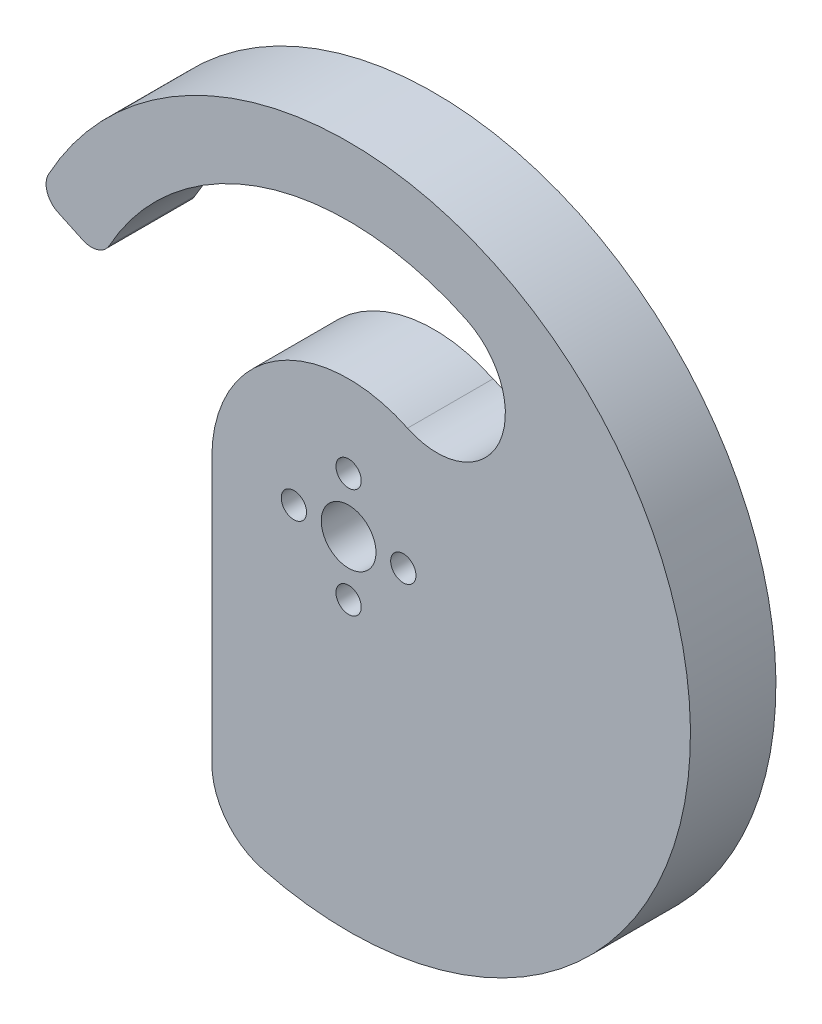
from build123d import *

# Parameters (mm, degrees)
SKETCH1_R           = 4
SKETCH1_R_2         = 1.85
BOSS_EXTRUDE1_DEPTH = 12.5
FILLET1_R           = 10
FILLET2_R           = 3
FILLET3_R           = 10


with BuildPart() as part:
    # Sketch1 → Boss-Extrude1 (new body)
    with BuildSketch(Plane.XY):
        with BuildLine():
            Line((14.142135624, 14.142135624), (28.284271247, 28.284271247))
            ThreePointArc((28.284271247, 28.284271247), (-6.945927107, 39.39231012), (-36.252311481, 16.90473047))
            Line((-36.252311481, 16.90473047), (-45.315389352, 21.130913087))
            ThreePointArc((-45.315389352, 21.130913087), (46.768835106, 17.682648638), (-20, -45.82575695))
            Line((-20, -45.82575695), (-20, 0))
            ThreePointArc((-20, 0), (-7.653668647, 18.47759065), (14.142135624, 14.142135624))
        make_face()
        Circle(SKETCH1_R, mode=Mode.SUBTRACT)
        with Locations((0, 8)):
            Circle(SKETCH1_R_2, mode=Mode.SUBTRACT)
        with Locations((8, 0)):
            Circle(SKETCH1_R_2, mode=Mode.SUBTRACT)
        with Locations((0, -8)):
            Circle(SKETCH1_R_2, mode=Mode.SUBTRACT)
        with Locations((-8, 0)):
            Circle(SKETCH1_R_2, mode=Mode.SUBTRACT)
    extrude(amount=BOSS_EXTRUDE1_DEPTH)

    # Fillet1
    fillet1_edges = [part.edges().sort_by_distance(p)[0] for p in [
        (28.284271247, 28.284271247, 6.25),
        (14.142135624, 14.142135624, 6.25),
    ]]
    fillet(fillet1_edges, radius=FILLET1_R - 0.0001)  # a hair under: the kernel refuses the full size

    # Fillet2
    fillet2_edges = [part.edges().sort_by_distance(p)[0] for p in [
        (-36.252311481, 16.90473047, 6.25),
        (-45.315389352, 21.130913087, 6.25),
    ]]
    fillet(fillet2_edges, radius=FILLET2_R)

    # Fillet3
    fillet3_edges = [part.edges().sort_by_distance(p)[0] for p in [
        (-20, -45.82575695, 6.25),
    ]]
    fillet(fillet3_edges, radius=FILLET3_R)


solid = part.part
